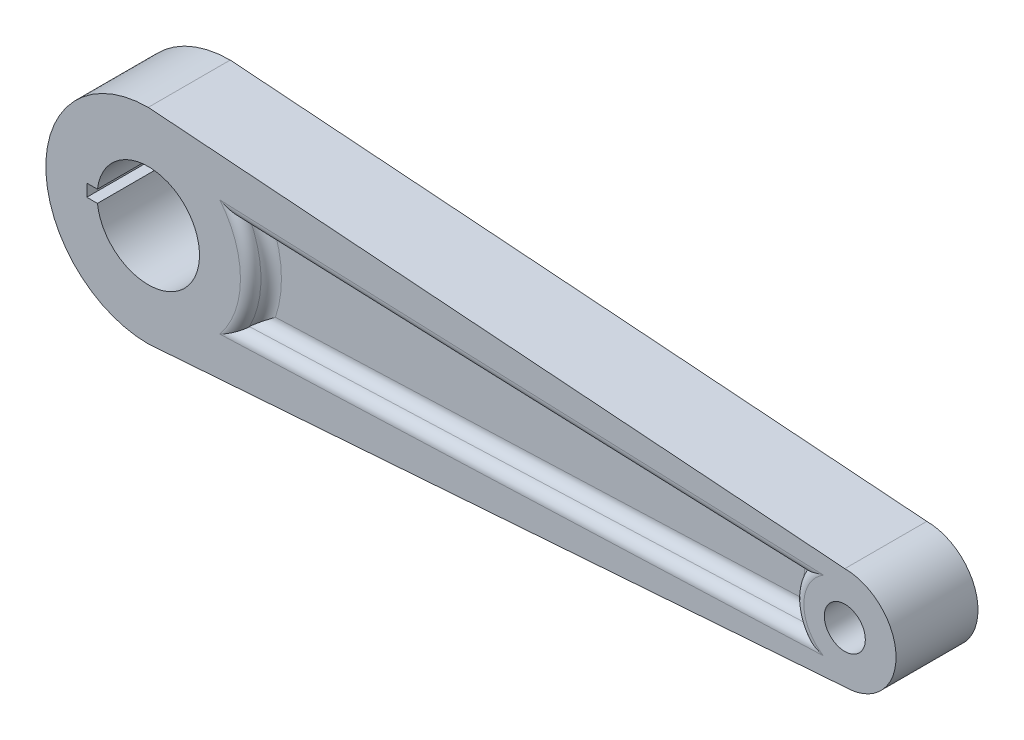
from build123d import *

# Parameters (mm, degrees)
SKETCH1_R            = 25
SKETCH1_R_2          = 10
BOSS_EXTRUDE1_DEPTH  = 20
CUT_EXTRUDE1_START   = -10
CUT_EXTRUDE1_DEPTH   = 10
FILLET1_R            = 5
FILLET1_OF_MIRROR1_R = 5
CUT_EXTRUDE2_DEPTH   = 371.573879285


with BuildPart() as part:
    # Sketch1 → Boss-Extrude1 (new body)
    with BuildSketch(Plane.XY):
        with BuildLine():
            Line((7.313400731, 49.462249946), (0, 50))
            ThreePointArc((0, 50), (-50, 0), (0, -50))
            Line((0, -50), (7.313400731, -49.462249946))
            Line((7.313400731, -49.462249946), (340, -25))
            ThreePointArc((340, -25), (365, 0), (340, 25))
            Line((340, 25), (7.313400731, 49.462249946))
        make_face()
        Circle(SKETCH1_R, mode=Mode.SUBTRACT)
        with Locations((340, 0)):
            Circle(SKETCH1_R_2, mode=Mode.SUBTRACT)
    boss_extrude1 = extrude(amount=BOSS_EXTRUDE1_DEPTH)

    # Sketch3 → Cut-Extrude1 (cut)
    with BuildSketch(Plane.XY.offset(20).offset(CUT_EXTRUDE1_START)):
        with BuildLine():
            Line((44.395945761, 23), (318.349364905, 12.5))
            ThreePointArc((318.349364905, 12.5), (315, 0), (318.349364905, -12.5))
            Line((318.349364905, -12.5), (44.395945761, -23))
            ThreePointArc((44.395945761, -23), (50, 0), (44.395945761, 23))
        make_face()
    cut_extrude1 = extrude(amount=CUT_EXTRUDE1_DEPTH, mode=Mode.SUBTRACT)

    # Fillet1
    # the kernel refuses this fillet: 5 mm, written as the material it adds along each edge
    with BuildSketch(Plane(origin=(340, 0, 10), x_dir=(-0.5202197990186777, 0.8540324119780036, 0), z_dir=(0.8540324119780036, 0.5202197990186777, 0))) as fillet1_piece_1:
        with BuildLine():
            CenterArc((25 + FILLET1_R, FILLET1_R), FILLET1_R, 180, 90)
            Line((25 + FILLET1_R, 0), (25, 0))
            Line((25, 0), (25, FILLET1_R))
        make_face()
    revolve(axis=Axis((340, 0, 10), (0, 0, 1)), revolution_arc=117.30600733)
    with BuildSketch(Plane(origin=(0, 0, 10), x_dir=(0.7464850985300688, -0.6654021323023795, 0), z_dir=(-0.6654021323023795, -0.7464850985300688, 0))) as fillet1_piece_2:
        with BuildLine():
            CenterArc((50 + FILLET1_R, FILLET1_R), FILLET1_R, 180, 90)
            Line((50 + FILLET1_R, 0), (50, 0))
            Line((50, 0), (50, FILLET1_R))
        make_face()
    revolve(axis=Axis((0, 0, 10), (0, 0, 1)), revolution_arc=83.426366568)
    with BuildSketch(Plane(origin=(330.840193688, -12.021255465, 10), x_dir=(0, 0, 1), z_dir=(-0.9992663025892244, -0.03829956278680695, 0)), Plane(origin=(31.905116978, 23.478744535, 10), x_dir=(0, 0, 1), z_dir=(0.9992663025892244, -0.03829956278680694, 0))) as fillet1_piece_3:
        with BuildLine():
            CenterArc((FILLET1_R, FILLET1_R), FILLET1_R, 180, 90)
            Line((0, FILLET1_R), (0, 0))
            Line((0, 0), (FILLET1_R, 0))
        make_face()
    extrude(amount=299.15456564)
    # the kernel refuses this fillet: 5 mm, written as the material it takes off along each edge
    with BuildSketch(Plane(origin=(340, 0, 20), x_dir=(-0.5202197990186777, 0.8540324119780036, 0), z_dir=(0.8540324119780036, 0.5202197990186777, 0))) as fillet1_2_piece_1_section:
        with BuildLine():
            CenterArc((25 - FILLET1_R, -FILLET1_R), FILLET1_R, 0, 90)
            Line((25, -FILLET1_R), (25, 0))
            Line((25, 0), (25 - FILLET1_R, 0))
        make_face()
    fillet1_2_piece_1 = revolve(axis=Axis((340, 0, 20), (0, 0, 1)), revolution_arc=117.30600733, mode=Mode.PRIVATE)
    fillet1_2_piece_1 = split(fillet1_2_piece_1, bisect_by=Plane(origin=(316.906736853, -12.555292592, 18.57447843), z_dir=(-0.03829956278680695, 0.9992663025892244, 0)), keep=Keep.TOP, mode=Mode.PRIVATE)
    fillet1_2_piece_1 = split(fillet1_2_piece_1, bisect_by=Plane(origin=(316.906736853, 12.555292592, 18.57447843), z_dir=(-0.03829956278680694, -0.9992663025892244, 0)), keep=Keep.TOP, mode=Mode.PRIVATE)
    add(fillet1_2_piece_1, mode=Mode.SUBTRACT)
    with BuildSketch(Plane(origin=(0, 0, 20), x_dir=(0.7464850985300688, -0.6654021323023795, 0), z_dir=(-0.6654021323023795, -0.7464850985300688, 0))) as fillet1_2_piece_2_section:
        with BuildLine():
            CenterArc((50 - FILLET1_R, -FILLET1_R), FILLET1_R, 0, 90)
            Line((50, -FILLET1_R), (50, 0))
            Line((50, 0), (50 - FILLET1_R, 0))
        make_face()
    fillet1_2_piece_2 = revolve(axis=Axis((0, 0, 20), (0, 0, 1)), revolution_arc=83.426366568, mode=Mode.PRIVATE)
    fillet1_2_piece_2 = split(fillet1_2_piece_2, bisect_by=Plane(origin=(49.457289241, -22.806010428, 18.583187686), z_dir=(-0.03829956278680695, 0.9992663025892244, 0)), keep=Keep.TOP, mode=Mode.PRIVATE)
    fillet1_2_piece_2 = split(fillet1_2_piece_2, bisect_by=Plane(origin=(49.457289241, 22.806010428, 18.583187686), z_dir=(-0.03829956278680694, -0.9992663025892244, 0)), keep=Keep.TOP, mode=Mode.PRIVATE)
    add(fillet1_2_piece_2, mode=Mode.SUBTRACT)
    with BuildSketch(Plane(origin=(330.840193688, -12.021255465, 20), x_dir=(0.03829956278680694, -0.9992663025892243, 0), z_dir=(-0.9992663025892244, -0.03829956278680695, 0))) as fillet1_2_piece_3_section:
        with BuildLine():
            CenterArc((FILLET1_R, -FILLET1_R), FILLET1_R, 90, 90)
            Line((0, -FILLET1_R), (0, 0))
            Line((0, 0), (FILLET1_R, 0))
        make_face()
    fillet1_2_piece_3 = extrude(amount=299.15456564, mode=Mode.PRIVATE)
    fillet1_2_piece_3 = fillet1_2_piece_3 - Plane(origin=(0, 0, 18.871101514), x_dir=(0.8879189152169247, -0.45999999999999963, 0), z_dir=(0, 0, -1)) * Cylinder(50, 619, mode=Mode.PRIVATE)
    fillet1_2_piece_3 = fillet1_2_piece_3 - Plane(origin=(340, 0, 18.871101514), x_dir=(-0.8660254037844374, 0.5000000000000023, 0), z_dir=(0, 0, -1)) * Cylinder(25, 619, mode=Mode.PRIVATE)
    add(fillet1_2_piece_3, mode=Mode.SUBTRACT)
    with BuildSketch(Plane(origin=(31.905116978, 23.478744535, 20), x_dir=(0.03829956278680694, 0.9992663025892246, 0), z_dir=(0.9992663025892244, -0.03829956278680694, 0))) as fillet1_2_piece_4_section:
        with BuildLine():
            CenterArc((FILLET1_R, -FILLET1_R), FILLET1_R, 90, 90)
            Line((0, -FILLET1_R), (0, 0))
            Line((0, 0), (FILLET1_R, 0))
        make_face()
    fillet1_2_piece_4 = extrude(amount=299.15456564, mode=Mode.PRIVATE)
    fillet1_2_piece_4 = fillet1_2_piece_4 - Plane(origin=(340, 0, 18.871101627), x_dir=(-0.8660254037844374, 0.5000000000000023, 0), z_dir=(0, 0, -1)) * Cylinder(25, 619, mode=Mode.PRIVATE)
    fillet1_2_piece_4 = fillet1_2_piece_4 - Plane(origin=(0, 0, 18.871101627), x_dir=(0.8879189152169247, -0.45999999999999963, 0), z_dir=(0, 0, -1)) * Cylinder(50, 619, mode=Mode.PRIVATE)
    add(fillet1_2_piece_4, mode=Mode.SUBTRACT)
    with BuildSketch(Plane(origin=(340, 0, 20), x_dir=(-0.5202197990186777, 0.8540324119780036, 0), z_dir=(0.8540324119780036, 0.5202197990186777, 0))) as fillet1_2_piece_5a_section:
        with BuildLine():
            CenterArc((25 - FILLET1_R, -FILLET1_R), FILLET1_R, 0, 90)
            Line((25, -FILLET1_R), (25, 0))
            Line((25, 0), (25 - FILLET1_R, 0))
        make_face()
    fillet1_2_piece_5a = revolve(axis=Axis((340, 0, 20), (0, 0, 1)), revolution_arc=117.30600733, mode=Mode.PRIVATE)
    fillet1_2_piece_5a = split(fillet1_2_piece_5a, bisect_by=Plane(origin=(323.032974468, 12.320488094, 18.805118145), z_dir=(0.03829956278680694, 0.9992663025892244, 0)), keep=Keep.TOP, mode=Mode.PRIVATE)
    with BuildSketch(Plane(origin=(31.905116978, 23.478744535, 20), x_dir=(0.03829956278680694, 0.9992663025892246, 0), z_dir=(0.9992663025892244, -0.03829956278680694, 0))) as fillet1_2_piece_5b_section:
        with BuildLine():
            CenterArc((FILLET1_R, -FILLET1_R), FILLET1_R, 90, 90)
            Line((0, -FILLET1_R), (0, 0))
            Line((0, 0), (FILLET1_R, 0))
        make_face()
    fillet1_2_piece_5b = extrude(amount=299.15456564, mode=Mode.PRIVATE)
    fillet1_2_piece_5b = fillet1_2_piece_5b & Plane(origin=(340, 0, 18.832020388), x_dir=(-0.8660254037844374, 0.5000000000000023, 0), z_dir=(0, 0, -1)) * Cylinder(25, 619, mode=Mode.PRIVATE)
    fillet1_2_piece_5 = fillet1_2_piece_5a & fillet1_2_piece_5b
    add(fillet1_2_piece_5, mode=Mode.SUBTRACT)
    with BuildSketch(Plane(origin=(330.840193688, -12.021255465, 20), x_dir=(0.03829956278680694, -0.9992663025892243, 0), z_dir=(-0.9992663025892244, -0.03829956278680695, 0))) as fillet1_2_piece_6a_section:
        with BuildLine():
            CenterArc((FILLET1_R, -FILLET1_R), FILLET1_R, 90, 90)
            Line((0, -FILLET1_R), (0, 0))
            Line((0, 0), (FILLET1_R, 0))
        make_face()
    fillet1_2_piece_6a = extrude(amount=299.15456564, mode=Mode.PRIVATE)
    fillet1_2_piece_6a = fillet1_2_piece_6a & Plane(origin=(340, 0, 18.832019441), x_dir=(-0.8660254037844374, 0.5000000000000023, 0), z_dir=(0, 0, -1)) * Cylinder(25, 619, mode=Mode.PRIVATE)
    with BuildSketch(Plane(origin=(340, 0, 20), x_dir=(-0.5202197990186777, 0.8540324119780036, 0), z_dir=(0.8540324119780036, 0.5202197990186777, 0))) as fillet1_2_piece_6b_section:
        with BuildLine():
            CenterArc((25 - FILLET1_R, -FILLET1_R), FILLET1_R, 0, 90)
            Line((25, -FILLET1_R), (25, 0))
            Line((25, 0), (25 - FILLET1_R, 0))
        make_face()
    fillet1_2_piece_6b = revolve(axis=Axis((340, 0, 20), (0, 0, 1)), revolution_arc=117.30600733, mode=Mode.PRIVATE)
    fillet1_2_piece_6b = split(fillet1_2_piece_6b, bisect_by=Plane(origin=(323.032974563, -12.32048809, 18.805118062), z_dir=(0.03829956278680695, -0.9992663025892244, 0)), keep=Keep.TOP, mode=Mode.PRIVATE)
    fillet1_2_piece_6 = fillet1_2_piece_6a & fillet1_2_piece_6b
    add(fillet1_2_piece_6, mode=Mode.SUBTRACT)
    with BuildSketch(Plane(origin=(330.840193688, -12.021255465, 20), x_dir=(0.03829956278680694, -0.9992663025892243, 0), z_dir=(-0.9992663025892244, -0.03829956278680695, 0))) as fillet1_2_piece_7a_section:
        with BuildLine():
            CenterArc((FILLET1_R, -FILLET1_R), FILLET1_R, 90, 90)
            Line((0, -FILLET1_R), (0, 0))
            Line((0, 0), (FILLET1_R, 0))
        make_face()
    fillet1_2_piece_7a = extrude(amount=299.15456564, mode=Mode.PRIVATE)
    fillet1_2_piece_7a = fillet1_2_piece_7a & Plane(origin=(0, 0, 18.832336867), x_dir=(0.8879189152169247, -0.45999999999999963, 0), z_dir=(0, 0, -1)) * Cylinder(50, 619, mode=Mode.PRIVATE)
    with BuildSketch(Plane(origin=(0, 0, 20), x_dir=(0.7464850985300688, -0.6654021323023795, 0), z_dir=(-0.6654021323023795, -0.7464850985300688, 0))) as fillet1_2_piece_7b_section:
        with BuildLine():
            CenterArc((50 - FILLET1_R, -FILLET1_R), FILLET1_R, 0, 90)
            Line((50, -FILLET1_R), (50, 0))
            Line((50, 0), (50 - FILLET1_R, 0))
        make_face()
    fillet1_2_piece_7b = revolve(axis=Axis((0, 0, 20), (0, 0, 1)), revolution_arc=83.426366568, mode=Mode.PRIVATE)
    fillet1_2_piece_7b = split(fillet1_2_piece_7b, bisect_by=Plane(origin=(39.868209821, -23.173537631, 18.819160113), z_dir=(0.03829956278680695, -0.9992663025892244, 0)), keep=Keep.TOP, mode=Mode.PRIVATE)
    fillet1_2_piece_7 = fillet1_2_piece_7a & fillet1_2_piece_7b
    add(fillet1_2_piece_7, mode=Mode.SUBTRACT)
    with BuildSketch(Plane(origin=(31.905116978, 23.478744535, 20), x_dir=(0.03829956278680694, 0.9992663025892246, 0), z_dir=(0.9992663025892244, -0.03829956278680694, 0))) as fillet1_2_piece_8a_section:
        with BuildLine():
            CenterArc((FILLET1_R, -FILLET1_R), FILLET1_R, 90, 90)
            Line((0, -FILLET1_R), (0, 0))
            Line((0, 0), (FILLET1_R, 0))
        make_face()
    fillet1_2_piece_8a = extrude(amount=299.15456564, mode=Mode.PRIVATE)
    fillet1_2_piece_8a = fillet1_2_piece_8a & Plane(origin=(0, 0, 18.832336054), x_dir=(0.8879189152169247, -0.45999999999999963, 0), z_dir=(0, 0, -1)) * Cylinder(50, 619, mode=Mode.PRIVATE)
    with BuildSketch(Plane(origin=(0, 0, 20), x_dir=(0.7464850985300688, -0.6654021323023795, 0), z_dir=(-0.6654021323023795, -0.7464850985300688, 0))) as fillet1_2_piece_8b_section:
        with BuildLine():
            CenterArc((50 - FILLET1_R, -FILLET1_R), FILLET1_R, 0, 90)
            Line((50, -FILLET1_R), (50, 0))
            Line((50, 0), (50 - FILLET1_R, 0))
        make_face()
    fillet1_2_piece_8b = revolve(axis=Axis((0, 0, 20), (0, 0, 1)), revolution_arc=83.426366568, mode=Mode.PRIVATE)
    fillet1_2_piece_8b = split(fillet1_2_piece_8b, bisect_by=Plane(origin=(39.868210179, 23.173537617, 18.819159945), z_dir=(0.03829956278680694, 0.9992663025892244, 0)), keep=Keep.TOP, mode=Mode.PRIVATE)
    fillet1_2_piece_8 = fillet1_2_piece_8a & fillet1_2_piece_8b
    add(fillet1_2_piece_8, mode=Mode.SUBTRACT)

    # Mirror1: Boss-Extrude1, Cut-Extrude1 across plane
    add(boss_extrude1.mirror(Plane.XY))
    add(cut_extrude1.mirror(Plane.XY), mode=Mode.SUBTRACT)

    # Fillet1 of Mirror1
    # the kernel refuses this fillet: 5 mm, written as the material it adds along each edge
    with BuildSketch(Plane(origin=(340, 0, -10), x_dir=(-0.5202197990186777, 0.8540324119780036, 0), z_dir=(0.8540324119780036, 0.5202197990186777, 0))) as fillet1_of_mirror1_piece_1:
        with BuildLine():
            CenterArc((25 + FILLET1_OF_MIRROR1_R, -FILLET1_OF_MIRROR1_R), FILLET1_OF_MIRROR1_R, 90, 90)
            Line((25 + FILLET1_OF_MIRROR1_R, 0), (25, 0))
            Line((25, 0), (25, -FILLET1_OF_MIRROR1_R))
        make_face()
    revolve(axis=Axis((340, 0, -10), (0, 0, 1)), revolution_arc=117.30600733)
    with BuildSketch(Plane(origin=(0, 0, -10), x_dir=(0.7464850985300688, -0.6654021323023795, 0), z_dir=(-0.6654021323023795, -0.7464850985300688, 0))) as fillet1_of_mirror1_piece_2:
        with BuildLine():
            CenterArc((50 + FILLET1_OF_MIRROR1_R, -FILLET1_OF_MIRROR1_R), FILLET1_OF_MIRROR1_R, 90, 90)
            Line((50 + FILLET1_OF_MIRROR1_R, 0), (50, 0))
            Line((50, 0), (50, -FILLET1_OF_MIRROR1_R))
        make_face()
    revolve(axis=Axis((0, 0, -10), (0, 0, 1)), revolution_arc=83.426366568)
    with BuildSketch(Plane(origin=(330.840193688, -12.021255465, -10), x_dir=(0, 0, -1), z_dir=(-0.9992663025892244, -0.03829956278680695, 0)), Plane(origin=(31.905116978, 23.478744535, -10), x_dir=(0, 0, -1), z_dir=(0.9992663025892244, -0.03829956278680694, 0))) as fillet1_of_mirror1_piece_3:
        with BuildLine():
            CenterArc((FILLET1_OF_MIRROR1_R, -FILLET1_OF_MIRROR1_R), FILLET1_OF_MIRROR1_R, 90, 90)
            Line((0, -FILLET1_OF_MIRROR1_R), (0, 0))
            Line((0, 0), (FILLET1_OF_MIRROR1_R, 0))
        make_face()
    extrude(amount=299.15456564)
    # the kernel refuses this fillet: 5 mm, written as the material it takes off along each edge
    with BuildSketch(Plane(origin=(340, 0, -20), x_dir=(-0.5202197990186777, 0.8540324119780036, 0), z_dir=(0.8540324119780036, 0.5202197990186777, 0))) as fillet1_of_mirror1_2_piece_1_section:
        with BuildLine():
            CenterArc((25 - FILLET1_OF_MIRROR1_R, FILLET1_OF_MIRROR1_R), FILLET1_OF_MIRROR1_R, 270, 90)
            Line((25, FILLET1_OF_MIRROR1_R), (25, 0))
            Line((25, 0), (25 - FILLET1_OF_MIRROR1_R, 0))
        make_face()
    fillet1_of_mirror1_2_piece_1 = revolve(axis=Axis((340, 0, -20), (0, 0, 1)), revolution_arc=117.30600733, mode=Mode.PRIVATE)
    fillet1_of_mirror1_2_piece_1 = split(fillet1_of_mirror1_2_piece_1, bisect_by=Plane(origin=(316.906736853, 12.555292592, -18.57447843), z_dir=(-0.03829956278680694, -0.9992663025892244, 0)), keep=Keep.TOP, mode=Mode.PRIVATE)
    fillet1_of_mirror1_2_piece_1 = split(fillet1_of_mirror1_2_piece_1, bisect_by=Plane(origin=(316.906736853, -12.555292592, -18.57447843), z_dir=(-0.03829956278680695, 0.9992663025892244, 0)), keep=Keep.TOP, mode=Mode.PRIVATE)
    add(fillet1_of_mirror1_2_piece_1, mode=Mode.SUBTRACT)
    with BuildSketch(Plane(origin=(0, 0, -20), x_dir=(0.7464850985300688, -0.6654021323023795, 0), z_dir=(-0.6654021323023795, -0.7464850985300688, 0))) as fillet1_of_mirror1_2_piece_2_section:
        with BuildLine():
            CenterArc((50 - FILLET1_OF_MIRROR1_R, FILLET1_OF_MIRROR1_R), FILLET1_OF_MIRROR1_R, 270, 90)
            Line((50, FILLET1_OF_MIRROR1_R), (50, 0))
            Line((50, 0), (50 - FILLET1_OF_MIRROR1_R, 0))
        make_face()
    fillet1_of_mirror1_2_piece_2 = revolve(axis=Axis((0, 0, -20), (0, 0, 1)), revolution_arc=83.426366568, mode=Mode.PRIVATE)
    fillet1_of_mirror1_2_piece_2 = split(fillet1_of_mirror1_2_piece_2, bisect_by=Plane(origin=(49.457289241, 22.806010428, -18.583187686), z_dir=(-0.03829956278680694, -0.9992663025892244, 0)), keep=Keep.TOP, mode=Mode.PRIVATE)
    fillet1_of_mirror1_2_piece_2 = split(fillet1_of_mirror1_2_piece_2, bisect_by=Plane(origin=(49.457289241, -22.806010428, -18.583187686), z_dir=(-0.03829956278680695, 0.9992663025892244, 0)), keep=Keep.TOP, mode=Mode.PRIVATE)
    add(fillet1_of_mirror1_2_piece_2, mode=Mode.SUBTRACT)
    with BuildSketch(Plane(origin=(330.840193688, -12.021255465, -20), x_dir=(0.03829956278680694, -0.9992663025892243, 0), z_dir=(-0.9992663025892244, -0.03829956278680695, 0))) as fillet1_of_mirror1_2_piece_3_section:
        with BuildLine():
            CenterArc((FILLET1_OF_MIRROR1_R, FILLET1_OF_MIRROR1_R), FILLET1_OF_MIRROR1_R, 180, 90)
            Line((0, FILLET1_OF_MIRROR1_R), (0, 0))
            Line((0, 0), (FILLET1_OF_MIRROR1_R, 0))
        make_face()
    fillet1_of_mirror1_2_piece_3 = extrude(amount=299.15456564, mode=Mode.PRIVATE)
    fillet1_of_mirror1_2_piece_3 = fillet1_of_mirror1_2_piece_3 - Plane(origin=(0, 0, -18.871101514), x_dir=(0.8879189152169247, -0.45999999999999963, 0), z_dir=(0, 0, 1)) * Cylinder(50, 619, mode=Mode.PRIVATE)
    fillet1_of_mirror1_2_piece_3 = fillet1_of_mirror1_2_piece_3 - Plane(origin=(340, 0, -18.871101514), x_dir=(-0.8660254037844374, 0.5000000000000023, 0), z_dir=(0, 0, 1)) * Cylinder(25, 619, mode=Mode.PRIVATE)
    add(fillet1_of_mirror1_2_piece_3, mode=Mode.SUBTRACT)
    with BuildSketch(Plane(origin=(31.905116978, 23.478744535, -20), x_dir=(0.03829956278680694, 0.9992663025892246, 0), z_dir=(0.9992663025892244, -0.03829956278680694, 0))) as fillet1_of_mirror1_2_piece_4_section:
        with BuildLine():
            CenterArc((FILLET1_OF_MIRROR1_R, FILLET1_OF_MIRROR1_R), FILLET1_OF_MIRROR1_R, 180, 90)
            Line((0, FILLET1_OF_MIRROR1_R), (0, 0))
            Line((0, 0), (FILLET1_OF_MIRROR1_R, 0))
        make_face()
    fillet1_of_mirror1_2_piece_4 = extrude(amount=299.15456564, mode=Mode.PRIVATE)
    fillet1_of_mirror1_2_piece_4 = fillet1_of_mirror1_2_piece_4 - Plane(origin=(0, 0, -18.871101627), x_dir=(0.8879189152169247, -0.45999999999999963, 0), z_dir=(0, 0, 1)) * Cylinder(50, 619, mode=Mode.PRIVATE)
    fillet1_of_mirror1_2_piece_4 = fillet1_of_mirror1_2_piece_4 - Plane(origin=(340, 0, -18.871101627), x_dir=(-0.8660254037844374, 0.5000000000000023, 0), z_dir=(0, 0, 1)) * Cylinder(25, 619, mode=Mode.PRIVATE)
    add(fillet1_of_mirror1_2_piece_4, mode=Mode.SUBTRACT)
    with BuildSketch(Plane(origin=(340, 0, -20), x_dir=(-0.5202197990186777, 0.8540324119780036, 0), z_dir=(0.8540324119780036, 0.5202197990186777, 0))) as fillet1_of_mirror1_2_piece_5a_section:
        with BuildLine():
            CenterArc((25 - FILLET1_OF_MIRROR1_R, FILLET1_OF_MIRROR1_R), FILLET1_OF_MIRROR1_R, 270, 90)
            Line((25, FILLET1_OF_MIRROR1_R), (25, 0))
            Line((25, 0), (25 - FILLET1_OF_MIRROR1_R, 0))
        make_face()
    fillet1_of_mirror1_2_piece_5a = revolve(axis=Axis((340, 0, -20), (0, 0, 1)), revolution_arc=117.30600733, mode=Mode.PRIVATE)
    fillet1_of_mirror1_2_piece_5a = split(fillet1_of_mirror1_2_piece_5a, bisect_by=Plane(origin=(323.032974468, 12.320488094, -18.805118145), z_dir=(0.03829956278680694, 0.9992663025892244, 0)), keep=Keep.TOP, mode=Mode.PRIVATE)
    with BuildSketch(Plane(origin=(31.905116978, 23.478744535, -20), x_dir=(0.03829956278680694, 0.9992663025892246, 0), z_dir=(0.9992663025892244, -0.03829956278680694, 0))) as fillet1_of_mirror1_2_piece_5b_section:
        with BuildLine():
            CenterArc((FILLET1_OF_MIRROR1_R, FILLET1_OF_MIRROR1_R), FILLET1_OF_MIRROR1_R, 180, 90)
            Line((0, FILLET1_OF_MIRROR1_R), (0, 0))
            Line((0, 0), (FILLET1_OF_MIRROR1_R, 0))
        make_face()
    fillet1_of_mirror1_2_piece_5b = extrude(amount=299.15456564, mode=Mode.PRIVATE)
    fillet1_of_mirror1_2_piece_5b = fillet1_of_mirror1_2_piece_5b & Plane(origin=(340, 0, -18.832020388), x_dir=(-0.8660254037844374, 0.5000000000000023, 0), z_dir=(0, 0, 1)) * Cylinder(25, 619, mode=Mode.PRIVATE)
    fillet1_of_mirror1_2_piece_5 = fillet1_of_mirror1_2_piece_5a & fillet1_of_mirror1_2_piece_5b
    add(fillet1_of_mirror1_2_piece_5, mode=Mode.SUBTRACT)
    with BuildSketch(Plane(origin=(330.840193688, -12.021255465, -20), x_dir=(0.03829956278680694, -0.9992663025892243, 0), z_dir=(-0.9992663025892244, -0.03829956278680695, 0))) as fillet1_of_mirror1_2_piece_6a_section:
        with BuildLine():
            CenterArc((FILLET1_OF_MIRROR1_R, FILLET1_OF_MIRROR1_R), FILLET1_OF_MIRROR1_R, 180, 90)
            Line((0, FILLET1_OF_MIRROR1_R), (0, 0))
            Line((0, 0), (FILLET1_OF_MIRROR1_R, 0))
        make_face()
    fillet1_of_mirror1_2_piece_6a = extrude(amount=299.15456564, mode=Mode.PRIVATE)
    fillet1_of_mirror1_2_piece_6a = fillet1_of_mirror1_2_piece_6a & Plane(origin=(340, 0, -18.832019441), x_dir=(-0.8660254037844374, 0.5000000000000023, 0), z_dir=(0, 0, 1)) * Cylinder(25, 619, mode=Mode.PRIVATE)
    with BuildSketch(Plane(origin=(340, 0, -20), x_dir=(-0.5202197990186777, 0.8540324119780036, 0), z_dir=(0.8540324119780036, 0.5202197990186777, 0))) as fillet1_of_mirror1_2_piece_6b_section:
        with BuildLine():
            CenterArc((25 - FILLET1_OF_MIRROR1_R, FILLET1_OF_MIRROR1_R), FILLET1_OF_MIRROR1_R, 270, 90)
            Line((25, FILLET1_OF_MIRROR1_R), (25, 0))
            Line((25, 0), (25 - FILLET1_OF_MIRROR1_R, 0))
        make_face()
    fillet1_of_mirror1_2_piece_6b = revolve(axis=Axis((340, 0, -20), (0, 0, 1)), revolution_arc=117.30600733, mode=Mode.PRIVATE)
    fillet1_of_mirror1_2_piece_6b = split(fillet1_of_mirror1_2_piece_6b, bisect_by=Plane(origin=(323.032974563, -12.32048809, -18.805118062), z_dir=(0.03829956278680695, -0.9992663025892244, 0)), keep=Keep.TOP, mode=Mode.PRIVATE)
    fillet1_of_mirror1_2_piece_6 = fillet1_of_mirror1_2_piece_6a & fillet1_of_mirror1_2_piece_6b
    add(fillet1_of_mirror1_2_piece_6, mode=Mode.SUBTRACT)
    with BuildSketch(Plane(origin=(330.840193688, -12.021255465, -20), x_dir=(0.03829956278680694, -0.9992663025892243, 0), z_dir=(-0.9992663025892244, -0.03829956278680695, 0))) as fillet1_of_mirror1_2_piece_7a_section:
        with BuildLine():
            CenterArc((FILLET1_OF_MIRROR1_R, FILLET1_OF_MIRROR1_R), FILLET1_OF_MIRROR1_R, 180, 90)
            Line((0, FILLET1_OF_MIRROR1_R), (0, 0))
            Line((0, 0), (FILLET1_OF_MIRROR1_R, 0))
        make_face()
    fillet1_of_mirror1_2_piece_7a = extrude(amount=299.15456564, mode=Mode.PRIVATE)
    fillet1_of_mirror1_2_piece_7a = fillet1_of_mirror1_2_piece_7a & Plane(origin=(0, 0, -18.832336867), x_dir=(0.8879189152169247, -0.45999999999999963, 0), z_dir=(0, 0, 1)) * Cylinder(50, 619, mode=Mode.PRIVATE)
    with BuildSketch(Plane(origin=(0, 0, -20), x_dir=(0.7464850985300688, -0.6654021323023795, 0), z_dir=(-0.6654021323023795, -0.7464850985300688, 0))) as fillet1_of_mirror1_2_piece_7b_section:
        with BuildLine():
            CenterArc((50 - FILLET1_OF_MIRROR1_R, FILLET1_OF_MIRROR1_R), FILLET1_OF_MIRROR1_R, 270, 90)
            Line((50, FILLET1_OF_MIRROR1_R), (50, 0))
            Line((50, 0), (50 - FILLET1_OF_MIRROR1_R, 0))
        make_face()
    fillet1_of_mirror1_2_piece_7b = revolve(axis=Axis((0, 0, -20), (0, 0, 1)), revolution_arc=83.426366568, mode=Mode.PRIVATE)
    fillet1_of_mirror1_2_piece_7b = split(fillet1_of_mirror1_2_piece_7b, bisect_by=Plane(origin=(39.868209821, -23.173537631, -18.819160113), z_dir=(0.03829956278680695, -0.9992663025892244, 0)), keep=Keep.TOP, mode=Mode.PRIVATE)
    fillet1_of_mirror1_2_piece_7 = fillet1_of_mirror1_2_piece_7a & fillet1_of_mirror1_2_piece_7b
    add(fillet1_of_mirror1_2_piece_7, mode=Mode.SUBTRACT)
    with BuildSketch(Plane(origin=(31.905116978, 23.478744535, -20), x_dir=(0.03829956278680694, 0.9992663025892246, 0), z_dir=(0.9992663025892244, -0.03829956278680694, 0))) as fillet1_of_mirror1_2_piece_8a_section:
        with BuildLine():
            CenterArc((FILLET1_OF_MIRROR1_R, FILLET1_OF_MIRROR1_R), FILLET1_OF_MIRROR1_R, 180, 90)
            Line((0, FILLET1_OF_MIRROR1_R), (0, 0))
            Line((0, 0), (FILLET1_OF_MIRROR1_R, 0))
        make_face()
    fillet1_of_mirror1_2_piece_8a = extrude(amount=299.15456564, mode=Mode.PRIVATE)
    fillet1_of_mirror1_2_piece_8a = fillet1_of_mirror1_2_piece_8a & Plane(origin=(0, 0, -18.832336054), x_dir=(0.8879189152169247, -0.45999999999999963, 0), z_dir=(0, 0, 1)) * Cylinder(50, 619, mode=Mode.PRIVATE)
    with BuildSketch(Plane(origin=(0, 0, -20), x_dir=(0.7464850985300688, -0.6654021323023795, 0), z_dir=(-0.6654021323023795, -0.7464850985300688, 0))) as fillet1_of_mirror1_2_piece_8b_section:
        with BuildLine():
            CenterArc((50 - FILLET1_OF_MIRROR1_R, FILLET1_OF_MIRROR1_R), FILLET1_OF_MIRROR1_R, 270, 90)
            Line((50, FILLET1_OF_MIRROR1_R), (50, 0))
            Line((50, 0), (50 - FILLET1_OF_MIRROR1_R, 0))
        make_face()
    fillet1_of_mirror1_2_piece_8b = revolve(axis=Axis((0, 0, -20), (0, 0, 1)), revolution_arc=83.426366568, mode=Mode.PRIVATE)
    fillet1_of_mirror1_2_piece_8b = split(fillet1_of_mirror1_2_piece_8b, bisect_by=Plane(origin=(39.868210179, 23.173537617, -18.819159945), z_dir=(0.03829956278680694, 0.9992663025892244, 0)), keep=Keep.TOP, mode=Mode.PRIVATE)
    fillet1_of_mirror1_2_piece_8 = fillet1_of_mirror1_2_piece_8a & fillet1_of_mirror1_2_piece_8b
    add(fillet1_of_mirror1_2_piece_8, mode=Mode.SUBTRACT)

    # Sketch6 → Cut-Extrude2 (cut, through all)
    with BuildSketch(Plane.XY.offset(20)):
        with BuildLine():
            Line((-30, 3), (-24.819347292, 3))
            ThreePointArc((-24.819347292, 3), (-25, 0), (-24.819347292, -3))
            Line((-24.819347292, -3), (-30, -3))
            Line((-30, -3), (-30, 3))
        make_face()
    extrude(amount=-CUT_EXTRUDE2_DEPTH, mode=Mode.SUBTRACT)


solid = part.part
